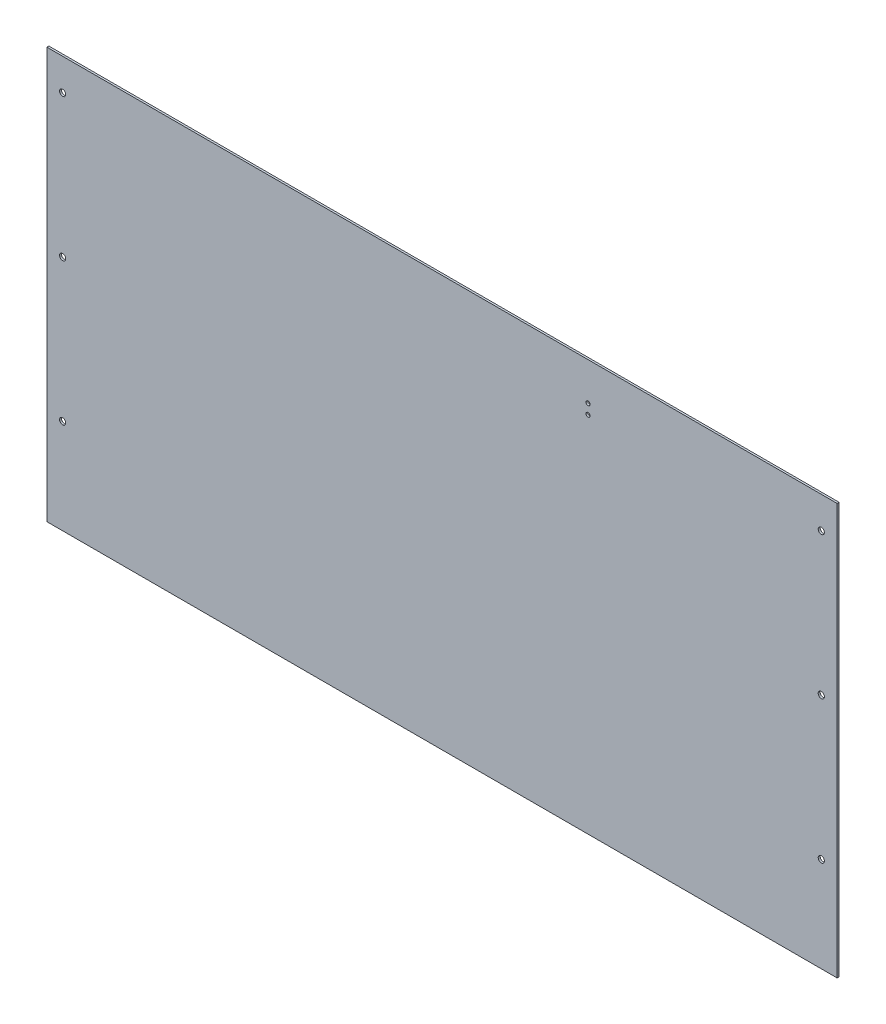
from build123d import *

# Parameters (mm, degrees)
SKETCH3_W                  = 635
SKETCH3_H                  = 330.2
BOSS_EXTRUDE1_DEPTH        = 0.79375
F_10_CLEARANCE_HOLE1_D     = 4.9784
F_3_2_3_2_DIAMETER_HOLE1_D = 3.2


with BuildPart() as part:
    # Sketch3 → Boss-Extrude1 (new, symmetric)
    with BuildSketch(Plane.XY):
        Rectangle(SKETCH3_W, SKETCH3_H)
    extrude(amount=BOSS_EXTRUDE1_DEPTH, both=True)

    # #10 Clearance Hole1 (through all)
    with Locations(Plane.XY.offset(0.79375)):
        with Locations((-304.8, 139.7), (-304.8, 25.4), (-304.8, -88.9), (304.735940926, 139.7), (304.735940926, 25.4), (304.735940926, -88.9)):
            Hole(F_10_CLEARANCE_HOLE1_D / 2)

    # Ø3.2 (3.2) Diameter Hole1 (through all)
    with Locations(Plane.XY.offset(0.79375)):
        with Locations((117.288403864, 134.7), (117.288403864, 126.7)):
            Hole(F_3_2_3_2_DIAMETER_HOLE1_D / 2)


solid = part.part
